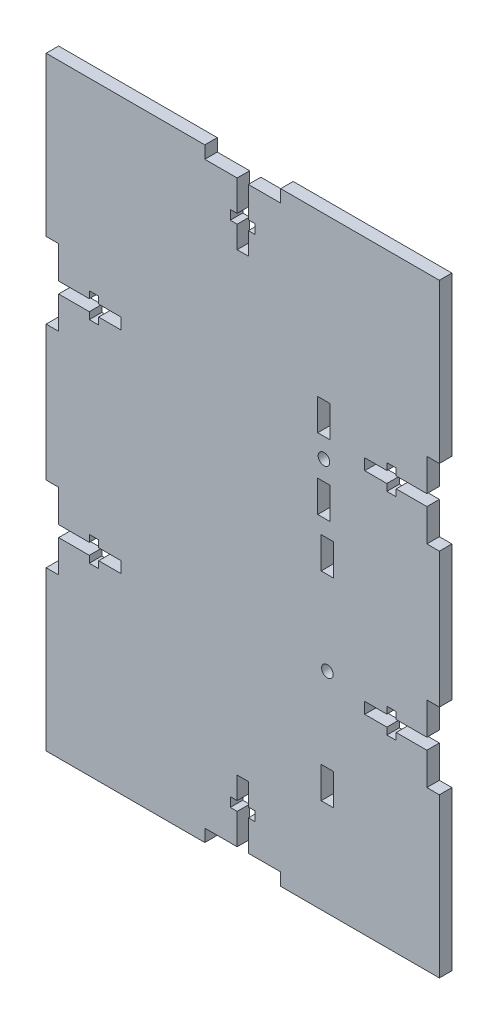
from build123d import *

# Parameters (mm, degrees)
BOSS_EXTRUDE1_DEPTH = 3.18
CUT_EXTRUDE9_DEPTH  = 92.718008183
CUT_EXTRUDE10_DEPTH = 92.718008183
SKETCH32_4_W        = 3.18
SKETCH32_4_H        = 8
SKETCH32_4_R        = 1.47
CUT_EXTRUDE18_DEPTH = 92.718008183
SKETCH33_R          = 1.47
SKETCH33_W          = 3.18
SKETCH33_H          = 8
CUT_EXTRUDE22_DEPTH = 92.718008183


with BuildPart() as part:
    # Sketch1 → Boss-Extrude1 (new body)
    with BuildSketch(Plane.XY):
        Polygon((-50, 76.825), (-16.666666667, 76.825), (16.666666667, 76.825), (50, 76.825), (50, -76.825), (-50, -76.825), align=None)
    extrude(amount=BOSS_EXTRUDE1_DEPTH)

    # Sketch20 → Cut-Extrude9 (cut, through all)
    with BuildSketch(Plane.XY.offset(3.18)):
        Polygon((-9.65, 76.825), (9.65, 76.825), (9.65, 73.645), (1.425, 73.645), (1.425, 65.845), (3.175, 65.845), (3.175, 63.465), (1.425, 63.465), (1.425, 57.845), (-1.425, 57.845), (-1.425, 63.465), (-3.175, 63.465), (-3.175, 65.845), (-1.425, 65.845), (-1.425, 73.645), (-9.65, 73.645), align=None)
    cut_extrude9 = extrude(amount=-CUT_EXTRUDE9_DEPTH, mode=Mode.SUBTRACT)

    # Mirror3: Cut-Extrude9 across plane
    add(cut_extrude9.mirror(Plane.ZX), mode=Mode.SUBTRACT)

    # Sketch23 → Cut-Extrude10 (cut, through all)
    with BuildSketch(Plane.XY.offset(3.18)):
        Polygon((-50, 17.175), (-50, 36.475), (-46.82, 36.475), (-46.82, 28.25), (-39.02, 28.25), (-39.02, 30), (-36.64, 30), (-36.64, 28.25), (-31.02, 28.25), (-31.02, 25.4), (-36.64, 25.4), (-36.64, 23.65), (-39.02, 23.65), (-39.02, 25.4), (-46.82, 25.4), (-46.82, 17.175), align=None)
        Polygon((-50, -36.475), (-50, -17.175), (-46.82, -17.175), (-46.82, -25.4), (-39.02, -25.4), (-39.02, -23.65), (-36.64, -23.65), (-36.64, -25.4), (-31.02, -25.4), (-31.02, -28.25), (-36.64, -28.25), (-36.64, -30), (-39.02, -30), (-39.02, -28.25), (-46.82, -28.25), (-46.82, -36.475), align=None)
    cut_extrude10 = extrude(amount=-CUT_EXTRUDE10_DEPTH, mode=Mode.SUBTRACT)

    # Mirror4: Cut-Extrude10 across plane
    add(cut_extrude10.mirror(Plane(origin=(0, 0, 0), x_dir=(0, 0, 1), z_dir=(1, 0, 0))), mode=Mode.SUBTRACT)

    # Sketch32<4> → Cut-Extrude18 (cut, through all)
    with BuildSketch(Plane.XY.offset(3.18)):
        with Locations((20.65, 13.782937163)):
            Rectangle(SKETCH32_4_W, SKETCH32_4_H)
        with Locations((20.65, 31.782937163)):
            Rectangle(SKETCH32_4_W, SKETCH32_4_H)
        with Locations((20.65, 22.782937163)):
            Circle(SKETCH32_4_R)
    extrude(amount=-CUT_EXTRUDE18_DEPTH, mode=Mode.SUBTRACT)

    # Sketch33 → Cut-Extrude22 (cut, through all)
    with BuildSketch(Plane.XY):
        with Locations((21.530032845, -23.511577341)):
            Circle(SKETCH33_R)
        with Locations((21.530032845, 1.788422659)):
            Rectangle(SKETCH33_W, SKETCH33_H)
        with Locations((21.530032845, -48.811577341)):
            Rectangle(SKETCH33_W, SKETCH33_H)
    extrude(amount=CUT_EXTRUDE22_DEPTH, mode=Mode.SUBTRACT)


solid = part.part
